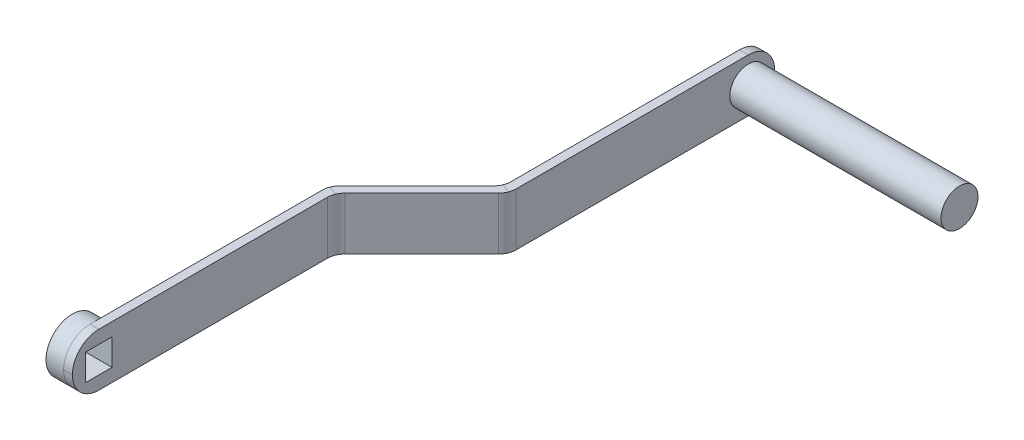
from build123d import *

# Parameters (mm, degrees)
SKETCH6_W               = 5
SKETCH6_H               = 30
SKETCH7_R               = 15
BOSS_EXTRUDE1_DEPTH     = 10
CUT_EXTRUDE1_DEPTH      = 281.256736501
CUT_EXTRUDE1_DEPTH_BACK = 281.256736501
SKETCH7_3_W             = 15
SKETCH7_3_H             = 15
FILLET1_R               = 10
FILLET2_R               = 15
SKETCH9_R               = 10.5
BOSS_EXTRUDE2_DEPTH     = 120


with BuildPart() as part:
    # Sweep1: sweep along a path in Sketch2
    with BuildLine(Plane(origin=(0, 0, 0), x_dir=(1, 0, 0), z_dir=(0, 1, 0))) as sweep1_path:
        Line((0, -75), (0, 75))
        Line((0, 75), (49.497474683, 124.497474683))
        Line((49.497474683, 124.497474683), (49.497474683, 274.497474683))
    # Sketch6 → Sweep1 (sweep)
    with BuildSketch(Plane.XY.offset(75)):
        Rectangle(SKETCH6_W, SKETCH6_H)
    sweep(path=sweep1_path.line, transition=Transition.RIGHT)

    # Sketch7 → Boss-Extrude1 (add)
    with BuildSketch(Plane.ZY.offset(2.5)):
        with Locations(Location((60, 0, 0), (0, 0, 270))):
            Circle(SKETCH7_R)
    extrude(amount=BOSS_EXTRUDE1_DEPTH)

    # Sketch7<3> → Cut-Extrude1 (cut, two sides: drawn at the far end of the back side and taken through both)
    with BuildSketch(Plane.ZY.offset(2.5).offset(-CUT_EXTRUDE1_DEPTH_BACK)):
        with Locations((60, 0)):
            Rectangle(SKETCH7_3_W, SKETCH7_3_H)
    extrude(amount=CUT_EXTRUDE1_DEPTH + CUT_EXTRUDE1_DEPTH_BACK, mode=Mode.SUBTRACT)

    # Fillet1
    fillet1_edges = [part.edges().sort_by_distance(p)[0] for p in [
        (-2.5, 0, -76.035533906),
        (2.5, 0, -73.964466094),
        (51.997474683, 0, -123.461940777),
        (46.997474683, 0, -125.533008589),
    ]]
    fillet(fillet1_edges, radius=FILLET1_R)

    # Fillet2
    fillet2_edges = [part.edges().sort_by_distance(p)[0] for p in [
        (0, 15, 75),
        (0, -15, 75),
        (49.497474683, -15, -274.497474683),
        (49.497474683, 15, -274.497474683),
    ]]
    fillet(fillet2_edges, radius=FILLET2_R - 0.0001)  # a hair under: the kernel refuses the full size

    # Sketch9 → Boss-Extrude2 (add)
    with BuildSketch(Plane(origin=(51.997474683, 0, 0), x_dir=(0, 0, -1), z_dir=(1, 0, 0))):
        with Locations(Location((259.497474683, 0, 0), (0, 0, 90))):
            Circle(SKETCH9_R)
    extrude(amount=BOSS_EXTRUDE2_DEPTH)


solid = part.part
